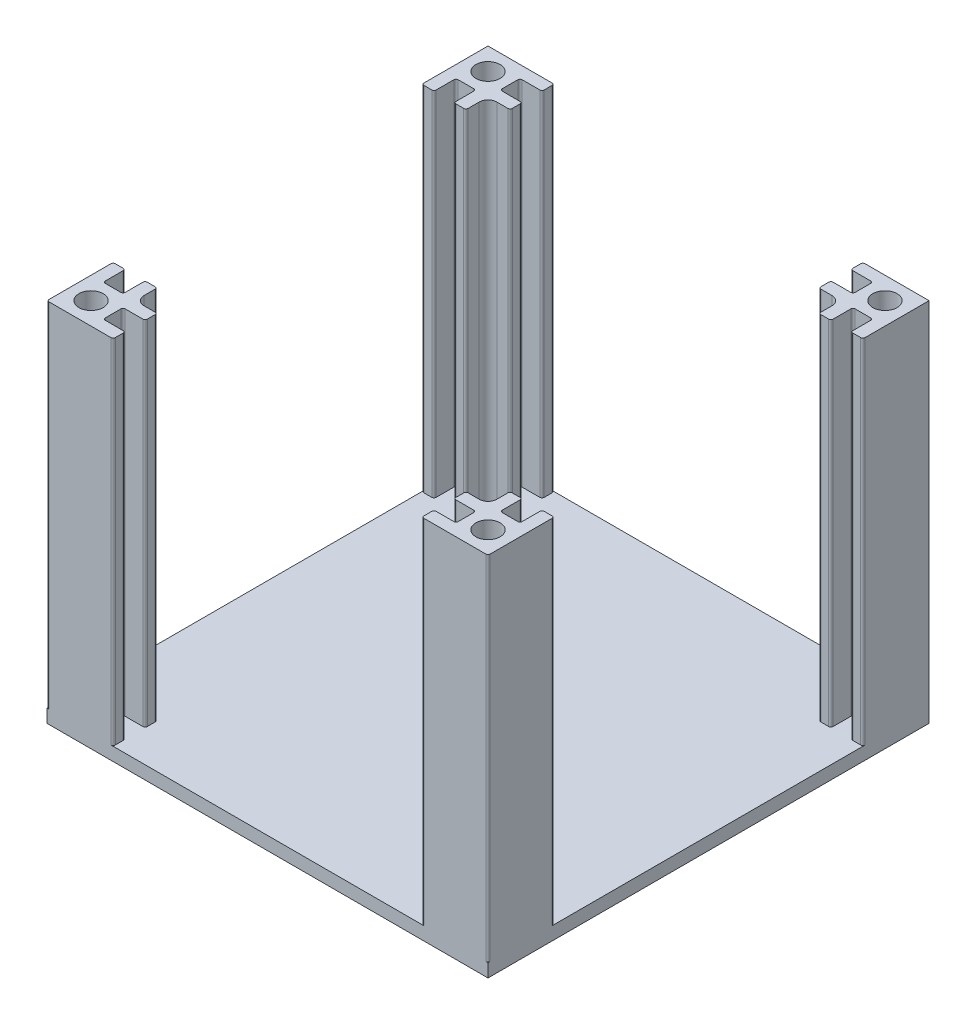
from build123d import *

# Parameters (mm, degrees)
SKETCH1_W           = 100
SKETCH1_H           = 100
BOSS_EXTRUDE1_DEPTH = 3
BOSS_EXTRUDE2_DEPTH = 80
SKETCH3_R           = 2.75
CUT_EXTRUDE1_DEPTH  = 6
FILLET3_R           = 2
FILLET4_R           = 0.5
MIRROR1_START       = 3
MIRROR1_DEPTH       = 74
MIRROR1_START_2     = 77
MIRROR1_2_OUTLINE_R = 2.75
MIRROR1_2_DEPTH     = 6


# Read off the part's stored shape, not the designer's step: Mirror1
with BuildPart() as part:
    # Sketch1 → Boss-Extrude1 (new body)
    with BuildSketch(Plane(origin=(0, 0, 0), x_dir=(1, 0, 0), z_dir=(0, 1, 0))):
        with Locations((50, 50)):
            Rectangle(SKETCH1_W, SKETCH1_H)
    extrude(amount=BOSS_EXTRUDE1_DEPTH)

    # Sketch2 → Boss-Extrude2 (add)
    with BuildSketch(Plane(origin=(0, 3, 0), x_dir=(1, 0, 0), z_dir=(0, 1, 0))):
        Polygon((0, 0), (10, 0), (15, 0), (15, 2.75), (10, 2.75), (10, 7.25), (15, 7.25), (15, 10), (10, 10), (10, 15), (7.25, 15), (7.25, 10), (2.75, 10), (2.75, 15), (0, 15), (0, 10), align=None)
    extrude(amount=BOSS_EXTRUDE2_DEPTH)

    # Sketch3 → Cut-Extrude1 (cut)
    with BuildSketch(Plane(origin=(0, 83, 0), x_dir=(1, 0, 0), z_dir=(0, 1, 0))):
        with Locations(Location((5, 5, 0), (0, 0, 270))):
            Circle(SKETCH3_R)
    extrude(amount=-CUT_EXTRUDE1_DEPTH, mode=Mode.SUBTRACT)

    # Fillet3
    fillet3_edges = [part.edges().sort_by_distance(p)[0] for p in [
        (10, 43, -10),
    ]]
    fillet(fillet3_edges, radius=FILLET3_R)

    # Fillet4
    fillet4_edges = [part.edges().sort_by_distance(p)[0] for p in [
        (7.25, 43, -10),
        (2.75, 43, -10),
        (10, 43, -7.25),
        (10, 43, -2.75),
        (0, 41.5, 0),
        (0, 43, -15),
        (2.75, 43, -15),
        (7.25, 43, -15),
        (10, 43, -15),
        (15, 43, -10),
        (15, 43, -7.25),
        (15, 43, -2.75),
        (15, 43, 0),
    ]]
    fillet(fillet4_edges, radius=FILLET4_R)

    # Mirror1 outline → Mirror1 (add)
    with BuildSketch(Plane(origin=(0, 0, 0), x_dir=(1, 0, 0), z_dir=(0, 1, 0)).offset(MIRROR1_START)):
        with BuildLine():
            Line((0, 100), (0, 85.5))
            ThreePointArc((0, 85.5), (0.146446609, 85.146446609), (0.5, 85))
            Line((0.5, 85), (2.25, 85))
            ThreePointArc((2.25, 85), (2.603553391, 85.146446609), (2.75, 85.5))
            Line((2.75, 85.5), (2.75, 89.5))
            ThreePointArc((2.75, 89.5), (2.896446609, 89.853553391), (3.25, 90))
            Line((3.25, 90), (6.75, 90))
            ThreePointArc((6.75, 90), (7.103553391, 89.853553391), (7.25, 89.5))
            Line((7.25, 89.5), (7.25, 85.5))
            ThreePointArc((7.25, 85.5), (7.396446609, 85.146446609), (7.75, 85))
            Line((7.75, 85), (9.5, 85))
            ThreePointArc((9.5, 85), (9.853553391, 85.146446609), (10, 85.5))
            Line((10, 85.5), (10, 88))
            ThreePointArc((10, 88), (10.585786438, 89.414213562), (12, 90))
            Line((12, 90), (14.5, 90))
            ThreePointArc((14.5, 90), (14.853553391, 90.146446609), (15, 90.5))
            Line((15, 90.5), (15, 92.25))
            ThreePointArc((15, 92.25), (14.853553391, 92.603553391), (14.5, 92.75))
            Line((14.5, 92.75), (10.5, 92.75))
            ThreePointArc((10.5, 92.75), (10.146446609, 92.896446609), (10, 93.25))
            Line((10, 93.25), (10, 96.75))
            ThreePointArc((10, 96.75), (10.146446609, 97.103553391), (10.5, 97.25))
            Line((10.5, 97.25), (14.5, 97.25))
            ThreePointArc((14.5, 97.25), (14.853553391, 97.396446609), (15, 97.75))
            Line((15, 97.75), (15, 99.5))
            ThreePointArc((15, 99.5), (14.853553391, 99.853553391), (14.5, 100))
            Line((14.5, 100), (0, 100))
        make_face()
    extrude(amount=MIRROR1_DEPTH)

    # Mirror1 2 outline → Mirror1 2 (add)
    with BuildSketch(Plane(origin=(0, 0, 0), x_dir=(1, 0, 0), z_dir=(0, 1, 0)).offset(MIRROR1_START_2)):
        with BuildLine():
            Line((0, 100), (0, 85.5))
            ThreePointArc((0, 85.5), (0.146446609, 85.146446609), (0.5, 85))
            Line((0.5, 85), (2.25, 85))
            ThreePointArc((2.25, 85), (2.603553391, 85.146446609), (2.75, 85.5))
            Line((2.75, 85.5), (2.75, 89.5))
            ThreePointArc((2.75, 89.5), (2.896446609, 89.853553391), (3.25, 90))
            Line((3.25, 90), (6.75, 90))
            ThreePointArc((6.75, 90), (7.103553391, 89.853553391), (7.25, 89.5))
            Line((7.25, 89.5), (7.25, 85.5))
            ThreePointArc((7.25, 85.5), (7.396446609, 85.146446609), (7.75, 85))
            Line((7.75, 85), (9.5, 85))
            ThreePointArc((9.5, 85), (9.853553391, 85.146446609), (10, 85.5))
            Line((10, 85.5), (10, 88))
            ThreePointArc((10, 88), (10.585786438, 89.414213562), (12, 90))
            Line((12, 90), (14.5, 90))
            ThreePointArc((14.5, 90), (14.853553391, 90.146446609), (15, 90.5))
            Line((15, 90.5), (15, 92.25))
            ThreePointArc((15, 92.25), (14.853553391, 92.603553391), (14.5, 92.75))
            Line((14.5, 92.75), (10.5, 92.75))
            ThreePointArc((10.5, 92.75), (10.146446609, 92.896446609), (10, 93.25))
            Line((10, 93.25), (10, 96.75))
            ThreePointArc((10, 96.75), (10.146446609, 97.103553391), (10.5, 97.25))
            Line((10.5, 97.25), (14.5, 97.25))
            ThreePointArc((14.5, 97.25), (14.853553391, 97.396446609), (15, 97.75))
            Line((15, 97.75), (15, 99.5))
            ThreePointArc((15, 99.5), (14.853553391, 99.853553391), (14.5, 100))
            Line((14.5, 100), (0, 100))
        make_face()
        with Locations((5, 95)):
            Circle(MIRROR1_2_OUTLINE_R, mode=Mode.SUBTRACT)
    extrude(amount=MIRROR1_2_DEPTH)

    # Mirror2: part across plane


with BuildPart() as part_1:
    add(part.part)
    add(part.part.mirror(Plane(origin=(50, 0, 0), x_dir=(0, 0, 1), z_dir=(1, 0, 0))))


solid = part_1.part
